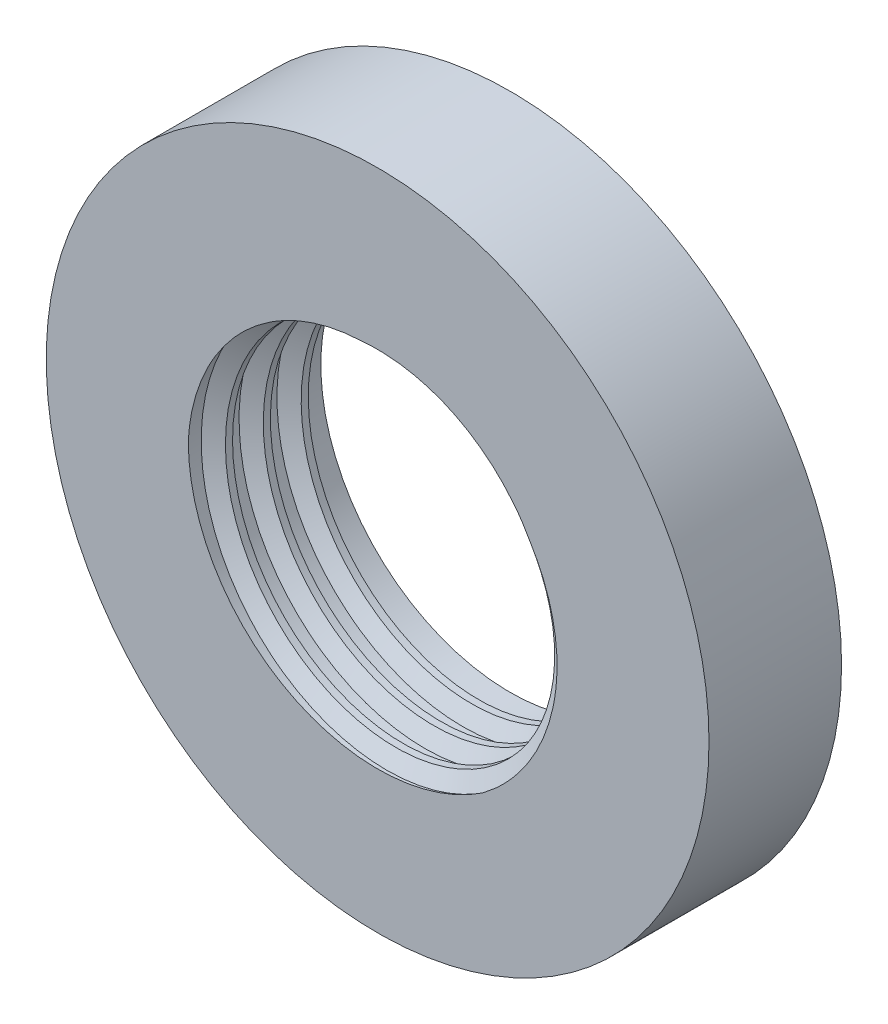
from build123d import *

# Parameters (mm, degrees)
SKETCH1_R           = 17.5
SKETCH1_R_2         = 10
BOSS_EXTRUDE1_DEPTH = 7
THREAD1_PITCH       = 2
SKETCH4_W           = 35
SKETCH4_H           = 2.231433202
CUT_EXTRUDE1_DEPTH  = 28.5


with BuildPart() as part:
    # Sketch1 → Boss-Extrude1 (new body)
    with BuildSketch(Plane.XY):
        Circle(SKETCH1_R)
        Circle(SKETCH1_R_2, mode=Mode.SUBTRACT)
    extrude(amount=BOSS_EXTRUDE1_DEPTH)

    # Thread1: the profile of Thread Profile1 profile screwed along a right-hand helix of 3.5 turns, 10 arcs to a turn; built about Z, then put on its axis
    thread1_z = Axis((0, 0, 0), (0, 0, 1))
    thread1_corners = [(10.0003, 0, -0.000173205), (10.0003, 0, 1.312673201), (9.188101187, 0, 0.843749998), (9.188101187, 0, 0.468749998)]
    with BuildLine(mode=Mode.PRIVATE) as thread1_profile:
        Line(thread1_corners[0], thread1_corners[1])
        Line(thread1_corners[1], thread1_corners[2])
        Line(thread1_corners[2], thread1_corners[3])
        Line(thread1_corners[3], thread1_corners[0])
    thread1_cap = Face(thread1_profile.wire())
    thread1_turn_angles = [0, 18, 36, 54, 72, 90, 108, 126, 144, 162, 180, 198, 216, 234, 252, 270, 288, 306, 324, 342, 360]
    thread1_turn_weights = [1, 0.9510565162951535, 1, 0.9510565162951535, 1, 0.9510565162951535, 1, 0.9510565162951535, 1, 0.9510565162951535, 1, 0.9510565162951535, 1, 0.9510565162951535, 1, 0.9510565162951535, 1, 0.9510565162951535, 1, 0.9510565162951535, 1]
    thread1_turn_rails = [Edge.make_bspline([Vector(p[0], p[1], 0).rotate(thread1_z, thread1_turn_angles[k]) / thread1_turn_weights[k] + Vector(0, 0, p[2] + THREAD1_PITCH * thread1_turn_angles[k] / 360) for k in range(21)], [0, 0, 0, 1, 1, 2, 2, 3, 3, 4, 4, 5, 5, 6, 6, 7, 7, 8, 8, 9, 9, 10, 10, 10], 2, thread1_turn_weights) for p in thread1_corners]
    thread1_turn_sides = [Face.make_surface_from_curves(thread1_turn_rails[p[0]], thread1_turn_rails[p[1]]) for p in [(0, 1), (1, 2), (2, 3), (3, 0)]]
    thread1_last_angles = [1080, 1098, 1116, 1134, 1152, 1170, 1188, 1206, 1224, 1242, 1260]
    thread1_last_weights = [1, 0.9510565162951535, 1, 0.9510565162951535, 1, 0.9510565162951535, 1, 0.9510565162951535, 1, 0.9510565162951535, 1]
    thread1_last_rails = [Edge.make_bspline([Vector(p[0], p[1], 0).rotate(thread1_z, thread1_last_angles[k]) / thread1_last_weights[k] + Vector(0, 0, p[2] + THREAD1_PITCH * thread1_last_angles[k] / 360) for k in range(11)], [0, 0, 0, 1, 1, 2, 2, 3, 3, 4, 4, 5, 5, 5], 2, thread1_last_weights) for p in thread1_corners]
    thread1_last_sides = [Face.make_surface_from_curves(thread1_last_rails[p[0]], thread1_last_rails[p[1]]) for p in [(0, 1), (1, 2), (2, 3), (3, 0)]]
    thread1 = Plane(origin=(0, 0, 0), x_dir=(1, 0, 0), z_dir=(0, 0, 1)) * Solid(Shell([*[p.moved(Location((0, 0, THREAD1_PITCH * i))) for i in range(3) for p in thread1_turn_sides], *thread1_last_sides, thread1_cap, thread1_cap.rotate(thread1_z, 1260).moved(Location((0, 0, THREAD1_PITCH * 1260 / 360)))]))
    add(thread1)

    # Sketch4 → Cut-Extrude1 (cut, symmetric)
    with BuildSketch(Plane(origin=(0, 0, 0), x_dir=(1, 0, 0), z_dir=(0, 1, 0))):
        with Locations((0, -8.115716601)):
            Rectangle(SKETCH4_W, SKETCH4_H)
    extrude(amount=CUT_EXTRUDE1_DEPTH, both=True, mode=Mode.SUBTRACT)


solid = part.part
